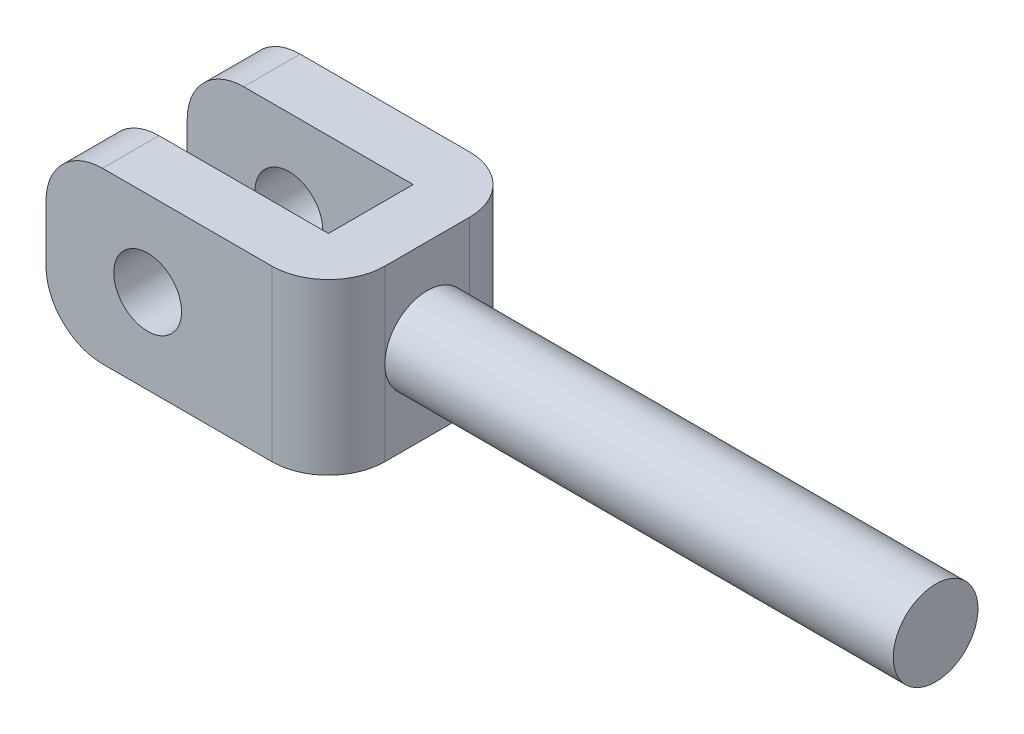
from build123d import *

# Parameters (mm, degrees)
SKETCH1_R                = 0.75
BOSS_EXTRUDE1_DEPTH      = 10
BOSS_EXTRUDE2_DEPTH      = 1.5
BOSS_EXTRUDE2_DEPTH_BACK = 1.5
FILLET1_R                = 1
SKETCH3_R                = 0.6
CUT_EXTRUDE1_DEPTH       = 5


with BuildPart() as part:
    # Sketch1 → Boss-Extrude1 (new body)
    with BuildSketch(Plane(origin=(0, 0, 0), x_dir=(0, 0, -1), z_dir=(1, 0, 0))):
        Circle(SKETCH1_R)
    extrude(amount=BOSS_EXTRUDE1_DEPTH)

    # Sketch2 → Boss-Extrude2 (add, two sides: drawn at the far end of the back side and taken through both)
    with BuildSketch(Plane(origin=(0, 0, 0), x_dir=(1, 0, 0), z_dir=(0, 1, 0)).offset(-BOSS_EXTRUDE2_DEPTH_BACK)):
        Polygon((1, 1.75), (1, -1.75), (-4, -1.75), (-4, -0.75), (0, -0.75), (0, 0.75), (-4, 0.75), (-4, 1.75), align=None)
    extrude(amount=BOSS_EXTRUDE2_DEPTH + BOSS_EXTRUDE2_DEPTH_BACK)

    # Fillet1
    fillet1_edges = [part.edges().sort_by_distance(p)[0] for p in [
        (-4, 1.5, 1.25),
        (-4, 1.5, -1.25),
        (-4, -1.5, -1.25),
        (1, 0, -1.75),
        (1, 0, 1.75),
        (-4, -1.5, 1.25),
    ]]
    fillet(fillet1_edges, radius=FILLET1_R - 0.0001)  # a hair under: the kernel refuses the full size

    # Sketch3 → Cut-Extrude1 (cut)
    with BuildSketch(Plane(origin=(0, 0, -1.75), x_dir=(-1, 0, 0), z_dir=(0, 0, -1))):
        with Locations((2.2, 0)):
            Circle(SKETCH3_R)
    extrude(amount=-CUT_EXTRUDE1_DEPTH, mode=Mode.SUBTRACT)


solid = part.part
